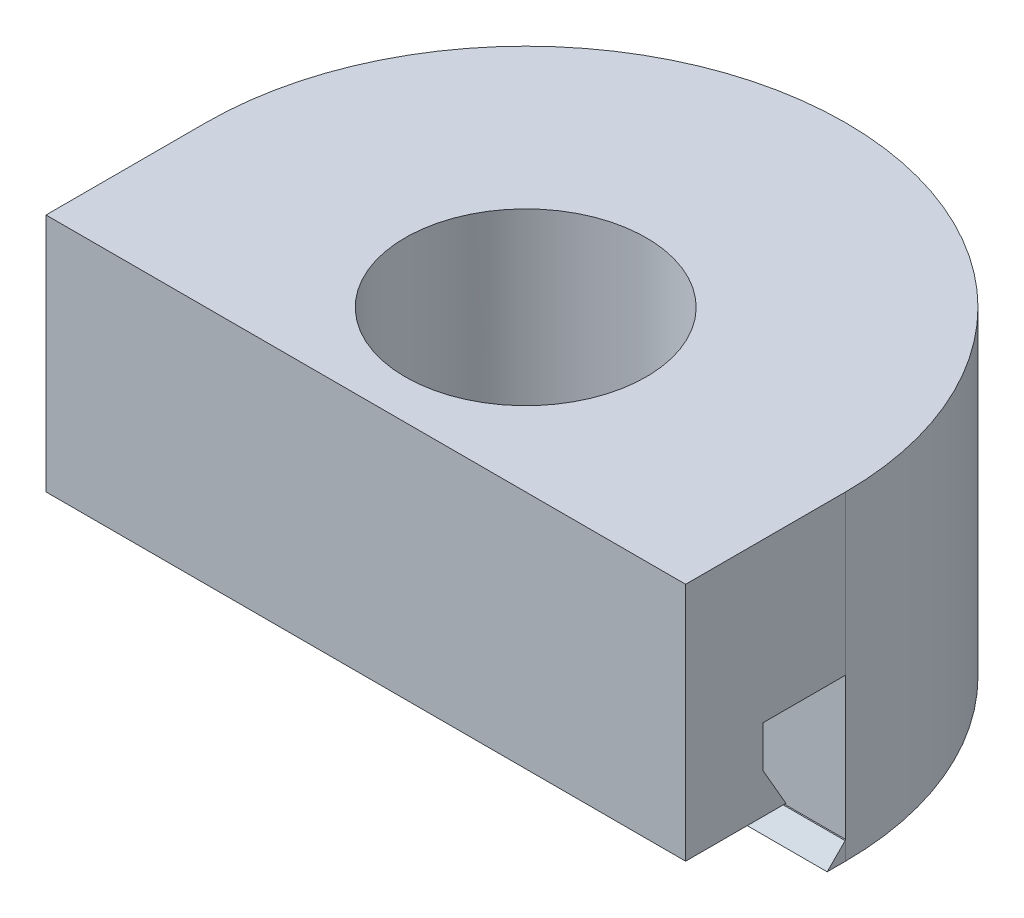
from build123d import *

# Parameters (mm, degrees)
SKETCH1_R           = 50.8
BOSS_EXTRUDE1_DEPTH = 50.8
SKETCH2_W           = 101.6
SKETCH2_H           = 101.6
CUT_EXTRUDE1_DEPTH  = 50.8
SKETCH3_W           = 101.6
SKETCH3_H           = 50.8
BOSS_EXTRUDE2_DEPTH = 25.4
SKETCH4_R           = 19.150000054
CUT_EXTRUDE2_DEPTH  = 50.8
CAVITY1_START       = -50.8
CAVITY1_DEPTH       = 101.6
SKETCH7_W           = 101.6
SKETCH7_H           = 22.400006
CUT_EXTRUDE3_DEPTH  = 0.2
SKETCH8_W           = 101.6
SKETCH8_H           = 4.242632202
CUT_EXTRUDE4_DEPTH  = 0.2
SKETCH9_W           = 101.6
SKETCH9_H           = 12.9
CUT_EXTRUDE5_DEPTH  = 0.2
SKETCH12_W          = 101.6
SKETCH12_H          = 6.55
CUT_EXTRUDE8_DEPTH  = 0.2
SKETCH13_W          = 101.6
SKETCH13_H          = 7.332348419
CUT_EXTRUDE9_DEPTH  = 0.2
FILLET3_R           = 0.2
FILLET4_R           = 0.2


with BuildPart() as part:
    # Sketch1 → Boss-Extrude1 (new body)
    with BuildSketch(Plane(origin=(0, 0, 0), x_dir=(1, 0, 0), z_dir=(0, 1, 0))):
        with Locations(Location((0, 0, 0), (0, 0, 270))):
            Circle(SKETCH1_R)
    extrude(amount=BOSS_EXTRUDE1_DEPTH)

    # Sketch2 → Cut-Extrude1 (cut)
    with BuildSketch(Plane(origin=(0, 50.8, 0), x_dir=(1, 0, 0), z_dir=(0, 1, 0))):
        with Locations((0, -50.8)):
            Rectangle(SKETCH2_W, SKETCH2_H)
    extrude(amount=-CUT_EXTRUDE1_DEPTH, mode=Mode.SUBTRACT)

    # Sketch3 → Boss-Extrude2 (add)
    with BuildSketch(Plane.XY):
        with Locations((0, 25.4)):
            Rectangle(SKETCH3_W, SKETCH3_H)
    extrude(amount=BOSS_EXTRUDE2_DEPTH)

    # Sketch4 → Cut-Extrude2 (cut)
    with BuildSketch(Plane(origin=(0, 50.8, 0), x_dir=(1, 0, 0), z_dir=(0, 1, 0))):
        with Locations(Location((0, 0, 0), (0, 0, 270))):
            Circle(SKETCH4_R)
    extrude(amount=-CUT_EXTRUDE2_DEPTH, mode=Mode.SUBTRACT)

    # Cavity1: read off the stored shape, not the designer's step
    # Cavity1 outline → Cavity1 (cut)
    with BuildSketch(Plane.YZ.offset(CAVITY1_START)):
        Polygon((19.05, 12.9), (12.7, 9.233825791), (12.7, 25.4), (0, 25.4), (0, 3.199994), (2.999994, 0.2), (25.4, 0.2), (25.4, 12.9), align=None)
    extrude(amount=CAVITY1_DEPTH, mode=Mode.SUBTRACT)

    # Sketch7 → Cut-Extrude3 (cut)
    with BuildSketch(Plane.XY.offset(0.2)):
        with Locations((0, 14.199997)):
            Rectangle(SKETCH7_W, SKETCH7_H)
    extrude(amount=-CUT_EXTRUDE3_DEPTH, mode=Mode.SUBTRACT)

    # Sketch8 → Cut-Extrude4 (cut)
    with BuildSketch(Plane(origin=(0, 1.599997, 1.599997), x_dir=(1, 0, 0), z_dir=(0, 0.7071067811865475, 0.7071067811865477))):
        with Locations((0, -0.141421356)):
            Rectangle(SKETCH8_W, SKETCH8_H)
    extrude(amount=-CUT_EXTRUDE4_DEPTH, mode=Mode.SUBTRACT)

    # Sketch9 → Cut-Extrude5 (cut)
    with BuildSketch(Plane.XZ.offset(-25.4)):
        with Locations((0, 6.45)):
            Rectangle(SKETCH9_W, SKETCH9_H)
    extrude(amount=-CUT_EXTRUDE5_DEPTH, mode=Mode.SUBTRACT)

    # Sketch12 → Cut-Extrude8 (cut)
    with BuildSketch(Plane(origin=(0, 0, 12.9), x_dir=(-1, 0, 0), z_dir=(0, 0, -1))):
        with Locations((0, 22.325)):
            Rectangle(SKETCH12_W, SKETCH12_H)
    extrude(amount=-CUT_EXTRUDE8_DEPTH, mode=Mode.SUBTRACT)

    # Sketch13 → Cut-Extrude9 (cut)
    with BuildSketch(Plane(origin=(0, -0.823363854, 1.426108029), x_dir=(-1, 0, 0), z_dir=(0, 0.4999999999999968, -0.8660254037844406))):
        with Locations((0, 19.281609733)):
            Rectangle(SKETCH13_W, SKETCH13_H)
    extrude(amount=-CUT_EXTRUDE9_DEPTH, mode=Mode.SUBTRACT)

    # Fillet3
    # the kernel refuses this fillet: 0.2 mm, written as the material it takes off along each edge
    with BuildSketch(Plane(origin=(-51.3, 19.05, 12.9), x_dir=(0, -1.0658141036380147e-12, 1.0), z_dir=(1, 0, 0))) as fillet3_piece_1:
        with BuildLine():
            CenterArc((0.373205081, 0.1), FILLET3_R, 180, 30)
            Line((0.173205081, 0.1), (0, 0))
            Line((0, 0), (0.2, 0))
        make_face()
    extrude(amount=37.646820072, mode=Mode.SUBTRACT)
    with BuildSketch(Plane(origin=(13.653179928, 19.05, 12.9), x_dir=(0, -0.4999999999991145, 0.86602540378495), z_dir=(1, 0, 0))) as fillet3_piece_2:
        with BuildLine():
            CenterArc((0.373205081, -0.1), FILLET3_R, 150, 30)
            Line((0.173205081, -0.1), (0, 0))
            Line((0, 0), (0.2, 0))
        make_face()
    extrude(amount=37.646820072, mode=Mode.SUBTRACT)

    # Fillet4
    # the kernel refuses this fillet: 0.2 mm, written as the material it takes off along each edge
    with BuildSketch(Plane(origin=(-51.3, 2.999994, 0.2), x_dir=(0, -1.4543921622385273e-11, -1.0), z_dir=(1, 0, 0))) as fillet4_piece_1:
        with BuildLine():
            CenterArc((0.341421356, -0.141421356), FILLET4_R, 135.000000001, 44.999999999)
            Line((0.141421356, -0.141421356), (0, 0))
            Line((0, 0), (0.2, 0))
        make_face()
    extrude(amount=32.651044361, mode=Mode.SUBTRACT)
    with BuildSketch(Plane(origin=(18.648955639, 2.999994, 0.2), x_dir=(0, -0.7071067811764699, -0.7071067811966253), z_dir=(1, 0, 0))) as fillet4_piece_2:
        with BuildLine():
            CenterArc((0.341421356, 0.141421356), FILLET4_R, 180, 44.999999999)
            Line((0.141421356, 0.141421356), (0, 0))
            Line((0, 0), (0.2, 0))
        make_face()
    extrude(amount=32.651044361, mode=Mode.SUBTRACT)


solid = part.part
